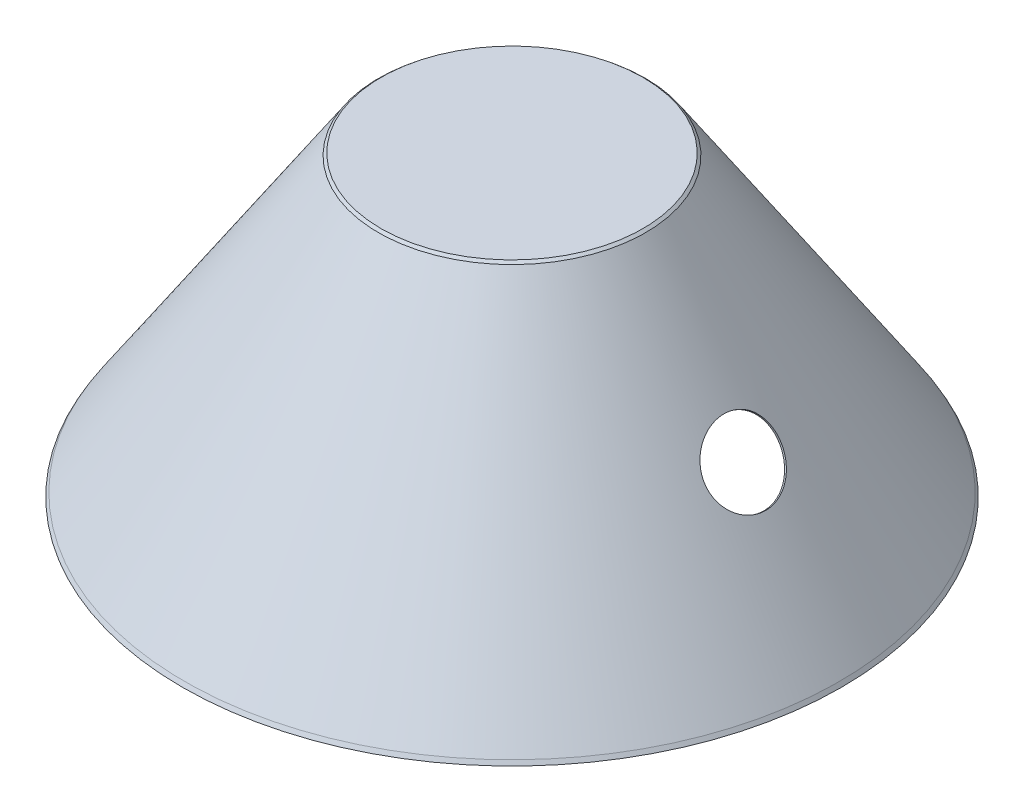
from build123d import *

# Parameters (mm, degrees)
SKETCH2_R          = 172.204020785
CUT_EXTRUDE1_DEPTH = 3412.561754711
CIRPATTERN1_COUNT  = 2


with BuildPart() as part:
    # Sketch1 → Revolve1 (revolve)
    with BuildSketch(Plane.XY):
        Polygon((0, 2000), (598.217, 2000), (1495.54, 650), (1505.54, 650), (1495.54, 668.065007493), (1055.206617095, 1330.535563716), (610.224516088, 2000), (598.217, 2010), (0, 2010), align=None)
    revolve(axis=Axis((0, 0, 0), (0, 1, 0)))

    # Sketch2 → Cut-Extrude1 (cut, through all)
    with BuildSketch(Plane(origin=(1345.253134586, 894.167835916, 0), x_dir=(0, 0, -1), z_dir=(0.8328117095112103, 0.5535563715657292, 0))):
        with Locations((0, 509.876242707)):
            Circle(SKETCH2_R)
    cut_extrude1 = extrude(amount=-CUT_EXTRUDE1_DEPTH, mode=Mode.SUBTRACT)

    # CirPattern1: Cut-Extrude1 ×2 about axis
    cirpattern1_axis = Axis((0, 0, 0), (0, -1, 0))
    for i in range(1, CIRPATTERN1_COUNT):
        add(cut_extrude1.rotate(cirpattern1_axis, i * 360 / CIRPATTERN1_COUNT), mode=Mode.SUBTRACT)


solid = part.part
